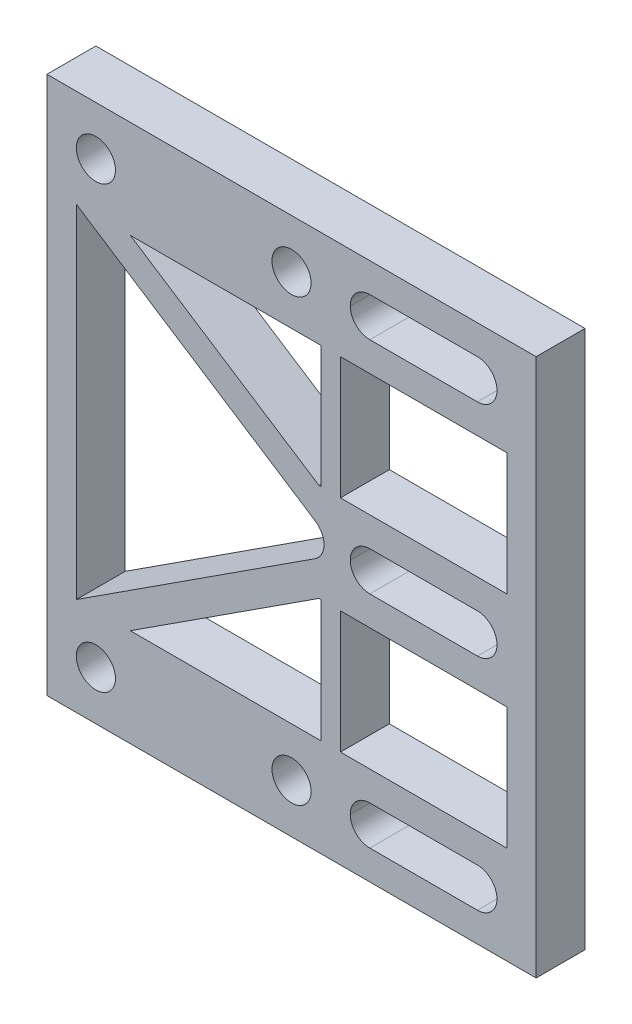
from build123d import *

# Parameters (mm, degrees)
SKETCH1_W           = 63.5
SKETCH1_H           = 69.85
BOSS_EXTRUDE1_DEPTH = 6.35
SKETCH2_R           = 2.54
SKETCH2_W           = 19.05
SKETCH2_H           = 5.08
CUT_EXTRUDE1_DEPTH  = 6.35
FILLET1_R           = 2.54
SKETCH3_W           = 21.59
SKETCH3_H           = 15.875
CUT_EXTRUDE2_DEPTH  = 7.62
FILLET3_R           = 2.54


with BuildPart() as part:
    # Sketch1 → Boss-Extrude1 (new body)
    with BuildSketch(Plane.XY):
        with Locations((3.891179619, 5.817505184)):
            Rectangle(SKETCH1_W, SKETCH1_H)
    extrude(amount=BOSS_EXTRUDE1_DEPTH)

    # Sketch2 → Cut-Extrude1 (cut)
    with BuildSketch(Plane.XY.offset(6.35)):
        with Locations((-21.508820381, 34.392505184)):
            Circle(SKETCH2_R)
        with Locations((3.891179619, 34.392505184)):
            Circle(SKETCH2_R)
        with Locations((-21.508820381, -22.757494816)):
            Circle(SKETCH2_R)
        with Locations((3.891179619, -22.757494816)):
            Circle(SKETCH2_R)
        with Locations((21.036179619, 34.392505184)):
            Rectangle(SKETCH2_W, SKETCH2_H)
        with Locations((21.036179619, -22.757494816)):
            Rectangle(SKETCH2_W, SKETCH2_H)
        with Locations((21.036179619, 5.817505184)):
            Rectangle(SKETCH2_W, SKETCH2_H)
    extrude(amount=-CUT_EXTRUDE1_DEPTH, mode=Mode.SUBTRACT)

    # Fillet1
    fillet1_edges = [part.edges().sort_by_distance(p)[0] for p in [
        (30.561179619, 31.852505184, 3.175),
        (30.561179619, 3.277505184, 3.175),
        (30.561179619, -25.297494816, 3.175),
        (30.561179619, -20.217494816, 3.175),
        (30.561179619, 8.357505184, 3.175),
        (30.561179619, 36.932505184, 3.175),
        (11.511179619, -20.217494816, 3.175),
        (11.511179619, 8.357505184, 3.175),
        (11.511179619, 36.932505184, 3.175),
        (11.511179619, 31.852505184, 3.175),
        (11.511179619, 3.277505184, 3.175),
        (11.511179619, -25.297494816, 3.175),
    ]]
    fillet(fillet1_edges, radius=FILLET1_R - 0.0001)  # a hair under: the kernel refuses the full size

    # Sketch3 → Cut-Extrude2 (cut)
    with BuildSketch(Plane.XY.offset(6.35)):
        Polygon((-17.043797687, -16.407494816), (7.701179619, -16.407494816), (7.701179619, -0.532494816), (7.449059455, -0.532494816), align=None)
        with Locations((21.036179619, -8.469994816)):
            Rectangle(SKETCH3_W, SKETCH3_H)
        Polygon((-24.048820381, -16.407494816), (10.241179619, 5.817505184), (-24.048820381, 28.042505184), align=None)
        Polygon((-17.043797687, 28.042505184), (7.449059455, 12.167505184), (7.701179619, 12.167505184), (7.701179619, 28.042505184), align=None)
        with Locations((21.036179619, 20.105005184)):
            Rectangle(SKETCH3_W, SKETCH3_H)
    extrude(amount=-CUT_EXTRUDE2_DEPTH, mode=Mode.SUBTRACT)

    # Fillet3
    fillet3_edges = [part.edges().sort_by_distance(p)[0] for p in [
        (10.241179619, 5.817505184, 3.175),
    ]]
    fillet(fillet3_edges, radius=FILLET3_R)


solid = part.part
